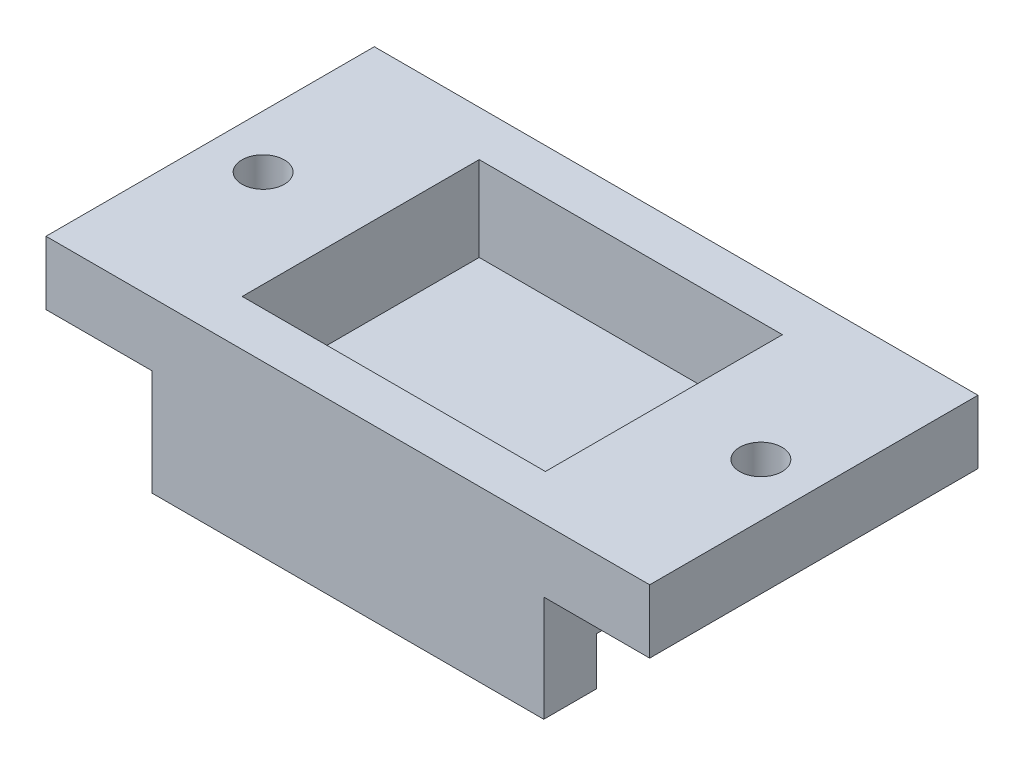
from build123d import *

# Parameters (mm, degrees)
SKETCH2_W           = 18.5
SKETCH2_H           = 15.5
BOSS_EXTRUDE1_DEPTH = 11
SKETCH3_W           = 18.5
SKETCH3_H           = 15.5
BOSS_EXTRUDE2_DEPTH = 3
SKETCH4_W           = 13.5
SKETCH4_H           = 10.5
CUT_EXTRUDE1_DEPTH  = 6
SKETCH5_W           = 3
SKETCH5_H           = 10.5
CUT_EXTRUDE2_DEPTH  = 26
SKETCH10_W          = 18.5
SKETCH10_H          = 5
CUT_EXTRUDE3_DEPTH  = 26
SKETCH11_W          = 15.5
SKETCH11_H          = 3
BOSS_EXTRUDE3_DEPTH = 5
SKETCH13_W          = 18.5
SKETCH13_H          = 2.498768597
BOSS_EXTRUDE4_DEPTH = 3
SKETCH14_W          = 15.5
SKETCH14_H          = 3
BOSS_EXTRUDE6_DEPTH = 5
SKETCH16_R          = 1
CUT_EXTRUDE5_DEPTH  = 5
SKETCH18_W          = 14.314551345
SKETCH18_H          = 11.188720745
CUT_EXTRUDE6_DEPTH  = 6
SKETCH19_W          = 10.504211387
SKETCH19_H          = 3.254689939
CUT_EXTRUDE7_DEPTH  = 2.5
SKETCH20_W          = 10.907275672
SKETCH20_H          = 11.188720745
BOSS_EXTRUDE7_DEPTH = 2
SKETCH23_W          = 18.5
SKETCH23_H          = 4
CUT_EXTRUDE8_DEPTH  = 22


with BuildPart() as part:
    # Sketch2 → Boss-Extrude1 (new body)
    with BuildSketch(Plane(origin=(0, 0, 0), x_dir=(1, 0, 0), z_dir=(0, 1, 0))):
        with Locations((-3.622916667, -0.966666667)):
            Rectangle(SKETCH2_W, SKETCH2_H)
    extrude(amount=BOSS_EXTRUDE1_DEPTH)

    # Sketch3 → Boss-Extrude2 (add)
    with BuildSketch(Plane(origin=(0, 11, 0), x_dir=(1, 0, 0), z_dir=(0, 1, 0))):
        with Locations((-3.622916667, -0.966666667)):
            Rectangle(SKETCH3_W, SKETCH3_H)
    extrude(amount=BOSS_EXTRUDE2_DEPTH)

    # Sketch4 → Cut-Extrude1 (cut)
    with BuildSketch(Plane(origin=(0, 14, 0), x_dir=(1, 0, 0), z_dir=(0, 1, 0))):
        with Locations((-3.622916667, -0.966666667)):
            Rectangle(SKETCH4_W, SKETCH4_H)
    extrude(amount=-CUT_EXTRUDE1_DEPTH, mode=Mode.SUBTRACT)

    # Sketch5 → Cut-Extrude2 (cut)
    with BuildSketch(Plane(origin=(0, 8, 0), x_dir=(1, 0, 0), z_dir=(0, 1, 0))):
        with Locations((1.627083333, -0.966666667)):
            Rectangle(SKETCH5_W, SKETCH5_H)
    extrude(amount=-CUT_EXTRUDE2_DEPTH, mode=Mode.SUBTRACT)

    # Sketch10 → Cut-Extrude3 (cut)
    with BuildSketch(Plane.XY.offset(8.716666667)):
        with Locations((-3.622916667, 2.5)):
            Rectangle(SKETCH10_W, SKETCH10_H)
    extrude(amount=-CUT_EXTRUDE3_DEPTH, mode=Mode.SUBTRACT)

    # Sketch11 → Boss-Extrude3 (add)
    with BuildSketch(Plane(origin=(5.627083333, 0, 0), x_dir=(0, 0, -1), z_dir=(1, 0, 0))):
        with Locations((-0.966666667, 12.5)):
            Rectangle(SKETCH11_W, SKETCH11_H)
    extrude(amount=BOSS_EXTRUDE3_DEPTH)

    # Sketch13 → Boss-Extrude4 (add)
    with BuildSketch(Plane.XZ.offset(-5)):
        Polygon((5.627083333, 6.217898069), (5.627083333, 8.716666667), (-12.872916667, 8.716666667), (-12.872916667, -4.283333333), (0.127083333, -4.283333333), (0.127083333, 6.217898069), align=None)
        with Locations((-3.622916667, -5.533949035)):
            Rectangle(SKETCH13_W, SKETCH13_H)
    extrude(amount=BOSS_EXTRUDE4_DEPTH)

    # Sketch14 → Boss-Extrude6 (add)
    with BuildSketch(Plane.ZY.offset(12.872916667)):
        with Locations((0.966666667, 12.5)):
            Rectangle(SKETCH14_W, SKETCH14_H)
    extrude(amount=BOSS_EXTRUDE6_DEPTH)

    # Sketch16 → Cut-Extrude5 (cut)
    with BuildSketch(Plane(origin=(0, 14, 0), x_dir=(1, 0, 0), z_dir=(0, 1, 0))):
        with Locations((-15.372916667, -0.966666667)):
            Circle(SKETCH16_R)
        with Locations((8.127083333, -0.966666667)):
            Circle(SKETCH16_R)
    extrude(amount=-CUT_EXTRUDE5_DEPTH, mode=Mode.SUBTRACT)

    # Sketch18 → Cut-Extrude6 (cut)
    with BuildSketch(Plane(origin=(0, 14, 0), x_dir=(1, 0, 0), z_dir=(0, 1, 0))):
        with Locations((-3.622916667, -0.952059982)):
            Rectangle(SKETCH18_W, SKETCH18_H)
    extrude(amount=-CUT_EXTRUDE6_DEPTH, mode=Mode.SUBTRACT)

    # Sketch19 → Cut-Extrude7 (cut)
    with BuildSketch(Plane(origin=(5.627083333, 0, 0), x_dir=(0, 0, -1), z_dir=(1, 0, 0))):
        with Locations((-0.965792375, 6.62734497)):
            Rectangle(SKETCH19_W, SKETCH19_H)
    extrude(amount=-CUT_EXTRUDE7_DEPTH, mode=Mode.SUBTRACT)

    # Sketch20 → Boss-Extrude7 (add)
    with BuildSketch(Plane(origin=(0, 8, 0), x_dir=(1, 0, 0), z_dir=(0, 1, 0))):
        with Locations((-5.326554503, -0.952059982)):
            Rectangle(SKETCH20_W, SKETCH20_H)
    extrude(amount=BOSS_EXTRUDE7_DEPTH)

    # Sketch23 → Cut-Extrude8 (cut)
    with BuildSketch(Plane.XY.offset(8.716666667)):
        with Locations((-3.622916667, 4)):
            Rectangle(SKETCH23_W, SKETCH23_H)
    extrude(amount=-CUT_EXTRUDE8_DEPTH, mode=Mode.SUBTRACT)


solid = part.part
